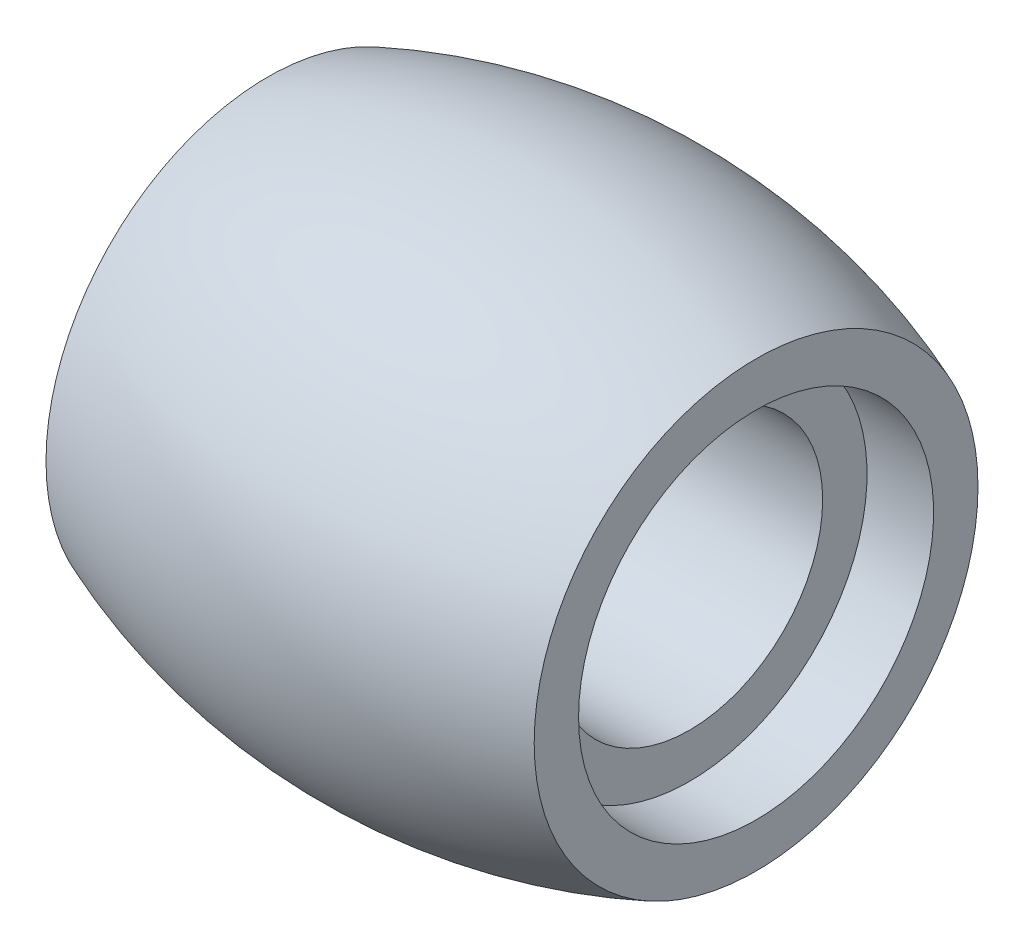
from build123d import *


with BuildPart() as part:
    # Sketch2 → Revolve1 (revolve)
    with BuildSketch(Plane.XY):
        with BuildLine():
            Line((-4, 3), (4, 3))
            Line((4, 3), (4, 4))
            Line((4, 4), (5.5, 4))
            Line((5.5, 4), (5.5, 5))
            ThreePointArc((5.5, 5), (0, 6.044714263), (-5.5, 5))
            Line((-5.5, 5), (-5.5, 4))
            Line((-5.5, 4), (-4, 4))
            Line((-4, 4), (-4, 3))
        make_face()
    revolve(axis=Axis((-8.91796875, 0, 0), (1, 0, 0)))


solid = part.part
